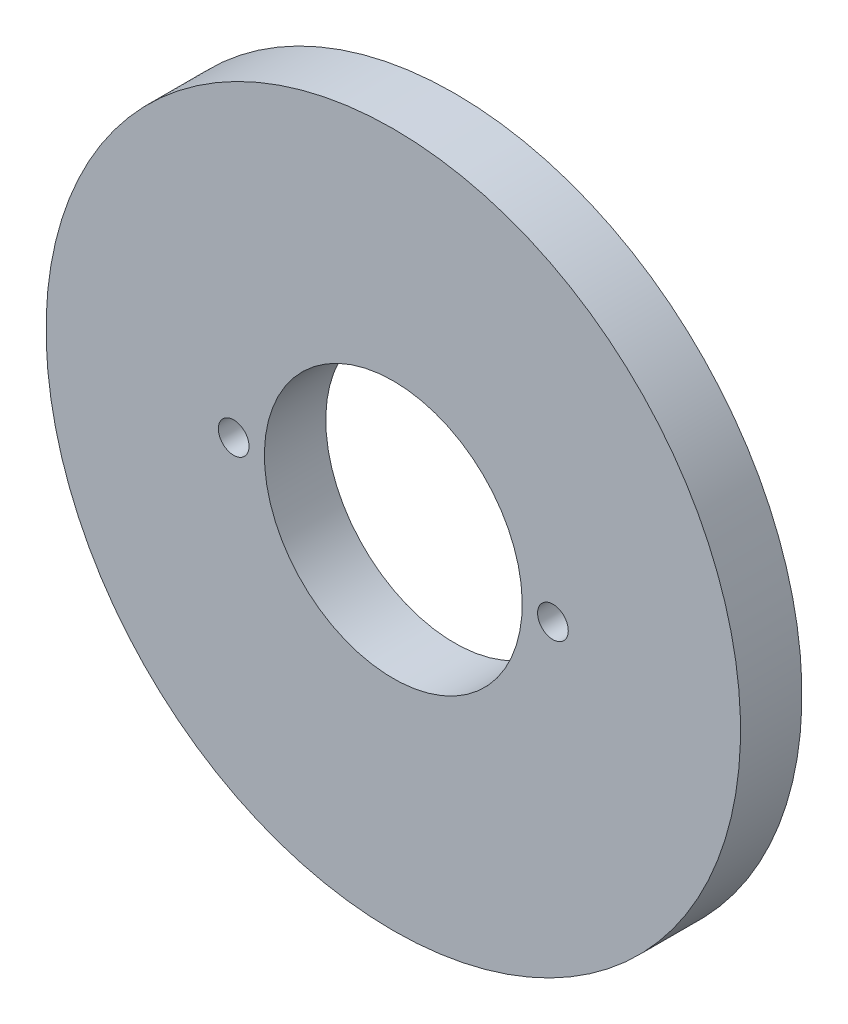
from build123d import *

# Parameters (mm, degrees)
SKETCH1_W          = 6.35
SKETCH1_H          = 22.5806
SKETCH3_R          = 1.5875
CUT_EXTRUDE1_DEPTH = 52.187724571


with BuildPart() as part:
    # Sketch1 → Revolve1 (revolve)
    with BuildSketch(Plane(origin=(0, 0, 0), x_dir=(0, 0, -1), z_dir=(1, 0, 0))):
        with Locations((12.7, 24.6253)):
            Rectangle(SKETCH1_W, SKETCH1_H)
    revolve(axis=Axis((0, 0, -15.875), (0, 0, 1)))

    # Sketch3 → Cut-Extrude1 (cut, through all)
    with BuildSketch(Plane(origin=(0, 0, -15.875), x_dir=(-1, 0, 0), z_dir=(0, 0, -1))):
        with Locations((16.51, 0)):
            Circle(SKETCH3_R)
        with Locations((-16.51, 0)):
            Circle(SKETCH3_R)
    extrude(amount=-CUT_EXTRUDE1_DEPTH, mode=Mode.SUBTRACT)


solid = part.part
